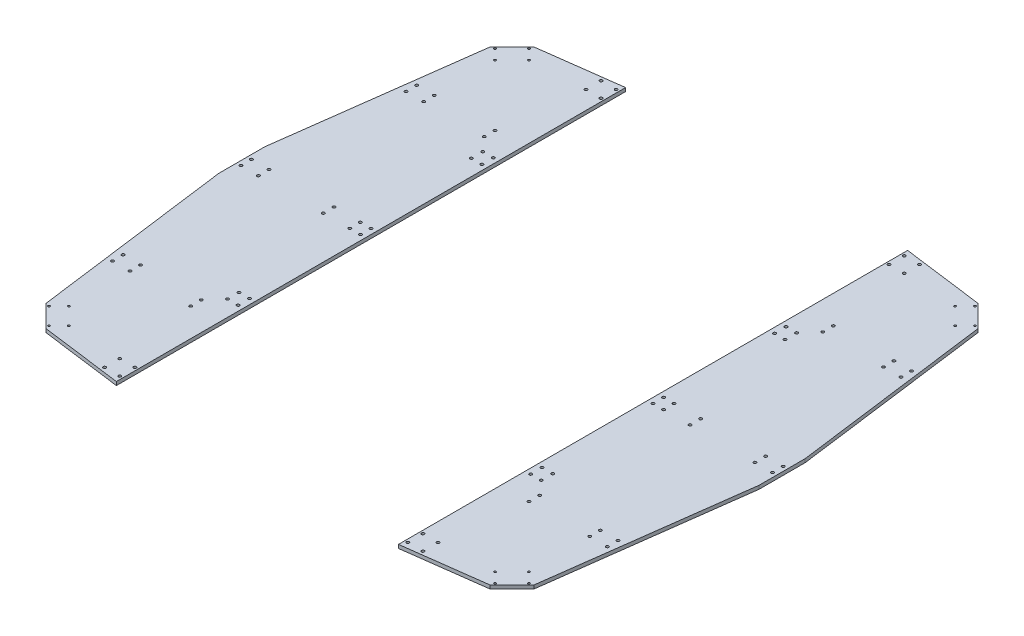
from build123d import *

# Parameters (mm, degrees)
SKETCH_1_R               = 1.5
SKETCH_1_R_2             = 2.000000001
SKETCH_1_R_3             = 2
SKETCH_1_R_4             = 2.000000003
SKETCH_1_R_5             = 1.999999999
SKETCH_1_R_6             = 250
EXTRUDE_2_DEPTH          = 5
CUT_EXTRUDE_1_DEPTH      = 542.772616539
CUT_EXTRUDE_1_DEPTH_BACK = 122
CUT_EXTRUDE_2_DEPTH      = 527.431195247
CUT_EXTRUDE_2_DEPTH_BACK = 39
SKETCH_3_R               = 2
CUT_EXTRUDE_3_DEPTH      = 20
CUT_EXTRUDE_3_DEPTH_BACK = 527.431195247
SKETCH_4_R               = 2
SKETCH_5_R               = 2
EXTRUDE_3_DEPTH          = 5


with BuildPart() as part:
    # 草图1 → 凸台-拉伸2 (new body)
    with BuildSketch(Plane(origin=(0, 0, 0), x_dir=(1, 0, 0), z_dir=(0, 1, 0))):
        Polygon((-32.720120418, 383.074776011), (-314.922171201, 345.922171201), (-345.922171201, 314.922171201), (-383.074776011, 32.720120418), (-383.074776011, -32.720120418), (-345.922171201, -314.922171201), (-314.922171201, -345.922171201), (-32.720120418, -383.074776011), (32.720120418, -383.074776011), (314.922171201, -345.922171201), (345.922171201, -314.922171201), (383.074776011, -32.720120418), (383.074776011, 32.720120418), (345.922171201, 314.922171201), (314.922171201, 345.922171201), (32.720120418, 383.074776011), (0, 383.074776011), align=None)
        with Locations((-316.280035574, -340.321666135)):
            Circle(SKETCH_1_R, mode=Mode.SUBTRACT)
        with Locations((-340.321666134, -316.280035574)):
            Circle(SKETCH_1_R, mode=Mode.SUBTRACT)
        with Locations((-302.137899951, -326.179530511)):
            Circle(SKETCH_1_R, mode=Mode.SUBTRACT)
        with Locations((-326.179530511, -302.137899951)):
            Circle(SKETCH_1_R, mode=Mode.SUBTRACT)
        with Locations((-350.918362047, -215.681953428)):
            Circle(SKETCH_1_R_2, mode=Mode.SUBTRACT)
        with Locations((-350.918362047, -200.681953428)):
            Circle(SKETCH_1_R_2, mode=Mode.SUBTRACT)
        with Locations((-325.918362047, -215.681953428)):
            Circle(SKETCH_1_R_2, mode=Mode.SUBTRACT)
        with Locations((-325.918362047, -200.681953428)):
            Circle(SKETCH_1_R_2, mode=Mode.SUBTRACT)
        with Locations((-240, -215.681953429)):
            Circle(SKETCH_1_R_3, mode=Mode.SUBTRACT)
        with Locations((-240, -200.681953429)):
            Circle(SKETCH_1_R_3, mode=Mode.SUBTRACT)
        with Locations((-222.5, -181.030079822)):
            Circle(SKETCH_1_R_3, mode=Mode.SUBTRACT)
        with Locations((-207.5, -181.030079822)):
            Circle(SKETCH_1_R_3, mode=Mode.SUBTRACT)
        with Locations((-222.5, -164.825516547)):
            Circle(SKETCH_1_R_3, mode=Mode.SUBTRACT)
        with Locations((-207.5, -164.825516547)):
            Circle(SKETCH_1_R_3, mode=Mode.SUBTRACT)
        with Locations((-377.074776011, -7.499878938)):
            Circle(SKETCH_1_R_3, mode=Mode.SUBTRACT)
        with Locations((-352.074776011, -7.499878938)):
            Circle(SKETCH_1_R_3, mode=Mode.SUBTRACT)
        with Locations((-260, -7.5)):
            Circle(SKETCH_1_R_3, mode=Mode.SUBTRACT)
        with Locations((316.280035574, -340.321666135)):
            Circle(SKETCH_1_R, mode=Mode.SUBTRACT)
        with Locations((302.13789995, -326.179530511)):
            Circle(SKETCH_1_R, mode=Mode.SUBTRACT)
        with Locations((326.179530511, -302.137899951)):
            Circle(SKETCH_1_R, mode=Mode.SUBTRACT)
        with Locations((340.321666135, -316.280035574)):
            Circle(SKETCH_1_R, mode=Mode.SUBTRACT)
        with Locations((240, -215.681953429)):
            Circle(SKETCH_1_R_3, mode=Mode.SUBTRACT)
        with Locations((240, -200.681953429)):
            Circle(SKETCH_1_R_3, mode=Mode.SUBTRACT)
        with Locations((325.918362046, -215.681953435)):
            Circle(SKETCH_1_R_4, mode=Mode.SUBTRACT)
        with Locations((325.918362046, -200.681953435)):
            Circle(SKETCH_1_R_4, mode=Mode.SUBTRACT)
        with Locations((350.918362046, -215.681953435)):
            Circle(SKETCH_1_R_4, mode=Mode.SUBTRACT)
        with Locations((350.918362046, -200.681953435)):
            Circle(SKETCH_1_R_4, mode=Mode.SUBTRACT)
        with Locations((207.5, -181.030079822)):
            Circle(SKETCH_1_R_3, mode=Mode.SUBTRACT)
        with Locations((222.5, -181.030079822)):
            Circle(SKETCH_1_R_3, mode=Mode.SUBTRACT)
        with Locations((207.5, -164.825516547)):
            Circle(SKETCH_1_R_3, mode=Mode.SUBTRACT)
        with Locations((222.5, -164.825516547)):
            Circle(SKETCH_1_R_3, mode=Mode.SUBTRACT)
        with Locations((260, -7.5)):
            Circle(SKETCH_1_R_3, mode=Mode.SUBTRACT)
        with Locations((352.074776011, -7.595099646)):
            Circle(SKETCH_1_R_3, mode=Mode.SUBTRACT)
        with Locations((377.074776011, -7.595099646)):
            Circle(SKETCH_1_R_3, mode=Mode.SUBTRACT)
        with Locations((-377.074776011, 7.500121062)):
            Circle(SKETCH_1_R_3, mode=Mode.SUBTRACT)
        with Locations((-352.074776011, 7.500121062)):
            Circle(SKETCH_1_R_3, mode=Mode.SUBTRACT)
        with Locations((-260, 7.5)):
            Circle(SKETCH_1_R_3, mode=Mode.SUBTRACT)
        with Locations((-222.5, 164.825516547)):
            Circle(SKETCH_1_R_3, mode=Mode.SUBTRACT)
        with Locations((-207.5, 164.825516547)):
            Circle(SKETCH_1_R_3, mode=Mode.SUBTRACT)
        with Locations((-222.5, 181.030079822)):
            Circle(SKETCH_1_R_3, mode=Mode.SUBTRACT)
        with Locations((-207.5, 181.030079822)):
            Circle(SKETCH_1_R_3, mode=Mode.SUBTRACT)
        with Locations((-350.918362047, 200.681953428)):
            Circle(SKETCH_1_R_5, mode=Mode.SUBTRACT)
        with Locations((-350.918362047, 215.681953428)):
            Circle(SKETCH_1_R_5, mode=Mode.SUBTRACT)
        with Locations((-325.918362047, 200.681953428)):
            Circle(SKETCH_1_R_5, mode=Mode.SUBTRACT)
        with Locations((-325.918362047, 215.681953428)):
            Circle(SKETCH_1_R_5, mode=Mode.SUBTRACT)
        with Locations((-240, 200.681953428)):
            Circle(SKETCH_1_R_3, mode=Mode.SUBTRACT)
        with Locations((-240, 215.681953428)):
            Circle(SKETCH_1_R_3, mode=Mode.SUBTRACT)
        with Locations((-340.321666134, 316.280035574)):
            Circle(SKETCH_1_R, mode=Mode.SUBTRACT)
        with Locations((-326.179530511, 302.137899951)):
            Circle(SKETCH_1_R, mode=Mode.SUBTRACT)
        with Locations((-302.13789995, 326.179530511)):
            Circle(SKETCH_1_R, mode=Mode.SUBTRACT)
        with Locations((-316.280035574, 340.321666134)):
            Circle(SKETCH_1_R, mode=Mode.SUBTRACT)
        Circle(SKETCH_1_R_6, mode=Mode.SUBTRACT)
        with Locations((260, 7.5)):
            Circle(SKETCH_1_R_3, mode=Mode.SUBTRACT)
        with Locations((352.074776011, 7.500121062)):
            Circle(SKETCH_1_R_3, mode=Mode.SUBTRACT)
        with Locations((377.074776011, 7.500121062)):
            Circle(SKETCH_1_R_3, mode=Mode.SUBTRACT)
        with Locations((207.5, 164.825516547)):
            Circle(SKETCH_1_R_3, mode=Mode.SUBTRACT)
        with Locations((222.5, 164.825516547)):
            Circle(SKETCH_1_R_3, mode=Mode.SUBTRACT)
        with Locations((207.5, 181.030079822)):
            Circle(SKETCH_1_R_3, mode=Mode.SUBTRACT)
        with Locations((222.5, 181.030079822)):
            Circle(SKETCH_1_R_3, mode=Mode.SUBTRACT)
        with Locations((240, 200.681953428)):
            Circle(SKETCH_1_R_3, mode=Mode.SUBTRACT)
        with Locations((240, 215.681953428)):
            Circle(SKETCH_1_R_3, mode=Mode.SUBTRACT)
        with Locations((325.918362046, 200.681953435)):
            Circle(SKETCH_1_R_5, mode=Mode.SUBTRACT)
        with Locations((325.918362046, 215.681953435)):
            Circle(SKETCH_1_R_5, mode=Mode.SUBTRACT)
        with Locations((350.918362046, 200.681953435)):
            Circle(SKETCH_1_R_5, mode=Mode.SUBTRACT)
        with Locations((350.918362046, 215.681953435)):
            Circle(SKETCH_1_R_5, mode=Mode.SUBTRACT)
        with Locations((326.179530511, 302.13789995)):
            Circle(SKETCH_1_R, mode=Mode.SUBTRACT)
        with Locations((302.137899951, 326.179530511)):
            Circle(SKETCH_1_R, mode=Mode.SUBTRACT)
        with Locations((340.321666135, 316.280035574)):
            Circle(SKETCH_1_R, mode=Mode.SUBTRACT)
        with Locations((316.280035574, 340.321666134)):
            Circle(SKETCH_1_R, mode=Mode.SUBTRACT)
    extrude(amount=EXTRUDE_2_DEPTH)

    # 草图2 → 切除-拉伸1 (cut, two sides: drawn at the far end of the back side and taken through both)
    with BuildSketch(Plane(origin=(0, 5, 0), x_dir=(1, 0, 0), z_dir=(0, 1, 0)).offset(-CUT_EXTRUDE_1_DEPTH_BACK)):
        Polygon((-200, 484.714921051), (-200, 361.051962068), (-200, -361.051962068), (-200, -418.819036359), (200, -418.819036359), (200, -361.051962068), (200, 361.051962068), (200, 484.714921051), align=None)
    extrude(amount=CUT_EXTRUDE_1_DEPTH + CUT_EXTRUDE_1_DEPTH_BACK, mode=Mode.SUBTRACT)


with BuildPart() as cut_extrude_1_piece_1:
    # of the separate pieces the step leaves, piece 1, a body of its own (cut_extrude_1_pieces)
    add(part.part.solids().sort_by_distance((-314.922171201, 0, 345.922171201))[0])

    # 草图3 → 切除-拉伸2 (cut, two sides: drawn at the far end of the back side and taken through both)
    with BuildSketch(Plane(origin=(0, 0, 0), x_dir=(-1, 0, 0), z_dir=(0, -1, 0)).offset(-CUT_EXTRUDE_2_DEPTH_BACK)):
        with Locations((225.752728605, -352.02249242)):
            Circle(SKETCH_3_R)
        with Locations((204.247271395, -352.02249242)):
            Circle(SKETCH_3_R)
        with Locations((225.752728605, -330.517035211)):
            Circle(SKETCH_3_R)
        with Locations((204.247271395, -330.517035211)):
            Circle(SKETCH_3_R)
    extrude(amount=CUT_EXTRUDE_2_DEPTH + CUT_EXTRUDE_2_DEPTH_BACK, mode=Mode.SUBTRACT)


with BuildPart() as cut_extrude_1_piece_2:
    # of the separate pieces the step leaves, piece 2, a body of its own (cut_extrude_1_pieces)
    add(part.part.solids().sort_by_distance((200, 0, 361.051962068))[0])


with BuildPart() as cut_extrude_3_tool:
    # 草图4 → 切除-拉伸3 (new, two sides: drawn at the far end of the back side and taken through both)
    with BuildSketch(Plane(origin=(0, 5, 0), x_dir=(1, 0, 0), z_dir=(0, 1, 0)).offset(-CUT_EXTRUDE_3_DEPTH_BACK)):
        with Locations((-204.247271395, 352.018568286)):
            Circle(SKETCH_4_R)
        with Locations((-225.752728605, 352.018568286)):
            Circle(SKETCH_4_R)
        with Locations((-225.752728605, 330.513111077)):
            Circle(SKETCH_4_R)
        with Locations((-204.247271395, 330.513111077)):
            Circle(SKETCH_4_R)
        with Locations((204.247271395, 330.513111077)):
            Circle(SKETCH_4_R)
        with Locations((225.752728605, 330.513111077)):
            Circle(SKETCH_4_R)
        with Locations((204.247271395, 352.018568286)):
            Circle(SKETCH_4_R)
        with Locations((225.752728605, 352.018568286)):
            Circle(SKETCH_4_R)
        with Locations((204.247271395, -352.02249242)):
            Circle(SKETCH_4_R)
        with Locations((225.752728605, -352.02249242)):
            Circle(SKETCH_4_R)
        with Locations((204.247271395, -330.517035211)):
            Circle(SKETCH_4_R)
        with Locations((225.752728605, -330.517035211)):
            Circle(SKETCH_4_R)
    extrude(amount=CUT_EXTRUDE_3_DEPTH + CUT_EXTRUDE_3_DEPTH_BACK)


with BuildPart() as cut_extrude_1_piece_1_1:
    add(cut_extrude_1_piece_1.part)

    # 切除-拉伸3: cut by cut_extrude_3_tool
    add(cut_extrude_3_tool.part, mode=Mode.SUBTRACT)



with BuildPart() as cut_extrude_1_piece_2_1:
    add(cut_extrude_1_piece_2.part)

    # 切除-拉伸3: cut by cut_extrude_3_tool
    add(cut_extrude_3_tool.part, mode=Mode.SUBTRACT)


with BuildPart() as cut_extrude_1_piece_1_2:
    add(cut_extrude_1_piece_1_1.part)

    add(cut_extrude_1_piece_2_1.part)  # 凸台-拉伸3 merges 切除-拉伸1 piece 2
    # 草图5 → 凸台-拉伸3 (add)
    # profile 1 of 2: a face of its own
    with BuildSketch(Plane(origin=(0, 5, 0), x_dir=(1, 0, 0), z_dir=(0, 1, 0))):
        with BuildLine():
            Line((-200, -150), (-200, 150))
            ThreePointArc((-200, 150), (-250, 0), (-200, -150))
        make_face()
        with Locations((-222.5, -7.5)):
            Circle(SKETCH_5_R, mode=Mode.SUBTRACT)
        with Locations((-207.5, -7.5)):
            Circle(SKETCH_5_R, mode=Mode.SUBTRACT)
        with Locations((-222.5, 7.5)):
            Circle(SKETCH_5_R, mode=Mode.SUBTRACT)
        with Locations((-207.5, 7.5)):
            Circle(SKETCH_5_R, mode=Mode.SUBTRACT)
    # profile 2 of 2: a face of its own
    with BuildSketch(Plane(origin=(0, 5, 0), x_dir=(1, 0, 0), z_dir=(0, 1, 0))):
        with BuildLine():
            ThreePointArc((200, -150), (250, 0), (200, 150))
            Line((200, 150), (200, -150))
        make_face()
        with Locations((207.5, -7.5)):
            Circle(SKETCH_5_R, mode=Mode.SUBTRACT)
        with Locations((222.5, -7.5)):
            Circle(SKETCH_5_R, mode=Mode.SUBTRACT)
        with Locations((207.5, 7.5)):
            Circle(SKETCH_5_R, mode=Mode.SUBTRACT)
        with Locations((222.5, 7.5)):
            Circle(SKETCH_5_R, mode=Mode.SUBTRACT)
    extrude(amount=-EXTRUDE_3_DEPTH)


solid = cut_extrude_1_piece_1_2.part
